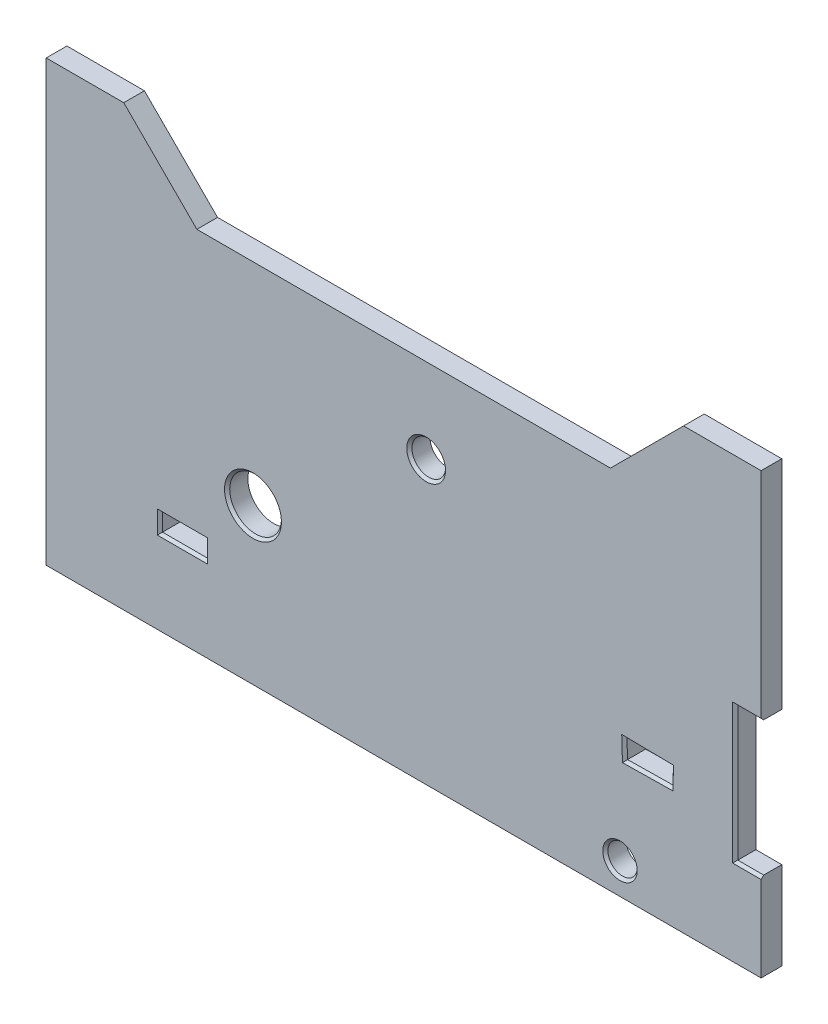
from build123d import *

# Parameters (mm, degrees)
SKETCH1_R           = 5
SKETCH1_R_2         = 2.83
SKETCH1_R_3         = 3.25
SKETCH1_W           = 8.7
SKETCH1_H           = 3.4
BOSS_EXTRUDE1_DEPTH = 2
BOSS_EXTRUDE2_DEPTH = 2
CHAMFER1_SIZE       = 0.5


with BuildPart() as part:
    # Sketch1 → Boss-Extrude1 (new, symmetric)
    with BuildSketch(Plane.XY):
        Polygon((-86, -30), (-86, 30), (52.3, 30), (52.3, 13), (47.3, 13), (47.3, -13), (52.3, -13), (52.3, -30), align=None)
        with Locations((-46, 0)):
            Circle(SKETCH1_R, mode=Mode.SUBTRACT)
        with Locations((25, -24)):
            Circle(SKETCH1_R_2, mode=Mode.SUBTRACT)
        with Locations((-12.5, 24.5)):
            Circle(SKETCH1_R_3, mode=Mode.SUBTRACT)
        Polygon((25.85051323, -3.175863678), (34.84948677, -3.311787274), (34.737207119, -6.688212726), (25.962792881, -6.824136322), align=None, mode=Mode.SUBTRACT)
        with Locations((-59.65, -12)):
            Rectangle(SKETCH1_W, SKETCH1_H, mode=Mode.SUBTRACT)
    extrude(amount=BOSS_EXTRUDE1_DEPTH, both=True)

    # Sketch2 → Boss-Extrude2 (add, symmetric)
    with BuildSketch(Plane.XY):
        Polygon((-86, 30), (52.3, 30), (52.3, 55), (37.3, 55), (23.157864376, 40.857864376), (-56.857864376, 40.857864376), (-71, 55), (-86, 55), align=None)
    extrude(amount=BOSS_EXTRUDE2_DEPTH, both=True)

    # Chamfer1
    chamfer1_edges = [part.edges().sort_by_distance(p)[0] for p in [
        (49.8, -13, 2),
        (49.8, 13, 2),
        (47.3, 0, 2),
        (22.17, -24, 2),
        (30.35, -6.756174524, 2),
        (25.906653056, -5, 2),
        (30.35, -3.243825476, 2),
        (34.793346944, -5, 2),
        (-55.3, -12, 2),
        (-59.65, -13.7, 2),
        (-64, -12, 2),
        (-59.65, -10.3, 2),
        (-51, 0, 2),
        (-15.75, 24.5, 2),
    ]]
    chamfer(chamfer1_edges, length=CHAMFER1_SIZE)


solid = part.part
